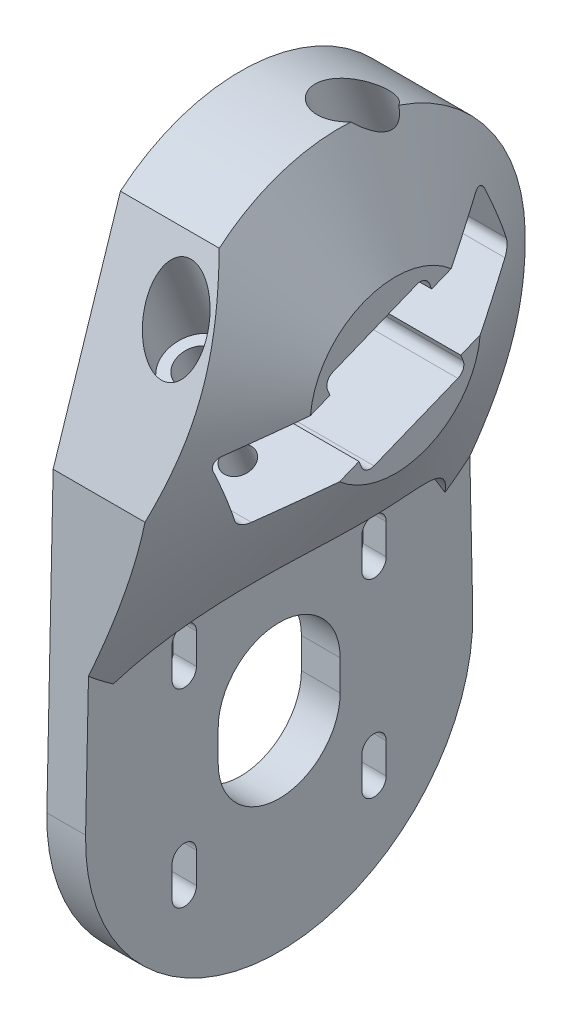
from build123d import *

# Parameters (mm, degrees)
BOSS_EXTRUDE1_DEPTH = 6.35
CUT_EXTRUDE18_DEPTH = 10
SKETCH20_R          = 57.15
BOSS_EXTRUDE5_DEPTH = 19.05
CUT_EXTRUDE14_DEPTH = 111.748555295
SKETCH22_R          = 3.175
CUT_EXTRUDE15_DEPTH = 117.849102749
SKETCH24_R          = 5
CUT_EXTRUDE16_DEPTH = 122.747909556
SKETCH25_R          = 2.38125
CUT_EXTRUDE17_DEPTH = 10
CHAMFER2_SIZE       = 2.5
FILLET1_R           = 1.5875
SKETCH28_R          = 31
CUT_EXTRUDE19_DEPTH = 110.466821527
CUT_EXTRUDE20_DEPTH = 106.059501871
CUT_EXTRUDE21_DEPTH = 101.035906079


with BuildPart() as part:
    # Sketch1 → Boss-Extrude1 (new body)
    with BuildSketch(Plane(origin=(0, 0, 0), x_dir=(0, 0, -1), z_dir=(1, 0, 0))):
        with BuildLine():
            ThreePointArc((30.473090912, 0.648945516), (0, 30.48), (-30.473090912, 0.648945516))
            Line((-30.473090912, 0.648945516), (-31.742803033, -58.974015088))
            ThreePointArc((-31.742803033, -58.974015088), (0, -91.4), (31.742803033, -58.974015088))
            Line((31.742803033, -58.974015088), (30.473090912, 0.648945516))
        make_face()
        Polygon((-11.716114032, 4.97319535), (4.97319535, 11.716114032), (11.716114032, -4.97319535), (-4.97319535, -11.716114032), align=None, mode=Mode.SUBTRACT)
    extrude(amount=BOSS_EXTRUDE1_DEPTH)

    # Sketch19 → Cut-Extrude18 (cut)
    with BuildSketch(Plane(origin=(6.35, 0, 0), x_dir=(0, 0, -1), z_dir=(1, 0, 0))):
        with BuildLine():
            Line((13.556349186, -39.093650814), (13.556349186, -44.093650814))
            ThreePointArc((13.556349186, -44.093650814), (15.556349186, -46.093650814), (17.556349186, -44.093650814))
            Line((17.556349186, -44.093650814), (17.556349186, -39.093650814))
            ThreePointArc((17.556349186, -39.093650814), (15.556349186, -37.093650814), (13.556349186, -39.093650814))
        make_face()
        with BuildLine():
            Line((-10, -54.65), (-10, -59.65))
            ThreePointArc((-10, -59.65), (0, -69.65), (10, -59.65))
            Line((10, -59.65), (10, -54.65))
            ThreePointArc((10, -54.65), (0, -44.65), (-10, -54.65))
        make_face()
        with BuildLine():
            Line((17.556349186, -75.206349186), (17.556349186, -70.206349186))
            ThreePointArc((17.556349186, -70.206349186), (15.556349186, -68.206349186), (13.556349186, -70.206349186))
            Line((13.556349186, -70.206349186), (13.556349186, -75.206349186))
            ThreePointArc((13.556349186, -75.206349186), (15.556349186, -77.206349186), (17.556349186, -75.206349186))
        make_face()
        with BuildLine():
            Line((-17.556349186, -39.093650814), (-17.556349186, -44.093650814))
            ThreePointArc((-17.556349186, -44.093650814), (-15.556349186, -46.093650814), (-13.556349186, -44.093650814))
            Line((-13.556349186, -44.093650814), (-13.556349186, -39.093650814))
            ThreePointArc((-13.556349186, -39.093650814), (-15.556349186, -37.093650814), (-17.556349186, -39.093650814))
        make_face()
        with BuildLine():
            Line((-13.556349186, -75.206349186), (-13.556349186, -70.206349186))
            ThreePointArc((-13.556349186, -70.206349186), (-15.556349186, -68.206349186), (-17.556349186, -70.206349186))
            Line((-17.556349186, -70.206349186), (-17.556349186, -75.206349186))
            ThreePointArc((-17.556349186, -75.206349186), (-15.556349186, -77.206349186), (-13.556349186, -75.206349186))
        make_face()
    extrude(amount=-CUT_EXTRUDE18_DEPTH, mode=Mode.SUBTRACT)

    # Sketch20 → Boss-Extrude5 (add)
    with BuildSketch(Plane(origin=(6.35, 0, 0), x_dir=(0, 0, -1), z_dir=(1, 0, 0))):
        Circle(SKETCH20_R)
    extrude(amount=BOSS_EXTRUDE5_DEPTH)

    # Sketch21 → Cut-Extrude14 (cut, through all)
    with BuildSketch(Plane.ZY):
        Polygon((-19.873660641, 14.878175718), (-24.631164378, 3.102940765), (-10.723406559, -2.516158136), (-11.716114032, -4.97319535), (4.97319535, -11.716114032), (5.965902823, -9.259076817), (19.873660641, -14.878175718), (24.631164378, -3.102940765), (10.723406559, 2.516158136), (11.716114032, 4.97319535), (-4.97319535, 11.716114032), (-5.965902823, 9.259076817), align=None)
    extrude(amount=-CUT_EXTRUDE14_DEPTH, mode=Mode.SUBTRACT)

    # Sketch22 → Cut-Extrude15 (cut, through all)
    with BuildSketch(Plane(origin=(0, 5.887617476, 2.378751868), x_dir=(1, 0, 0), z_dir=(0, -0.9271838545667871, -0.3746065934159129))):
        with Locations((12.5, 16.5)):
            Circle(SKETCH22_R)
    cut_extrude15 = extrude(amount=-CUT_EXTRUDE15_DEPTH, mode=Mode.SUBTRACT)

    # Sketch24 → Cut-Extrude16 (cut, through all)
    with BuildSketch(Plane(origin=(0, 10.597711458, 4.281753363), x_dir=(1, 0, 0), z_dir=(0, -0.9271838545667871, -0.3746065934159129))):
        with Locations((12.5, 16.5)):
            Circle(SKETCH24_R)
    cut_extrude16 = extrude(amount=-CUT_EXTRUDE16_DEPTH, mode=Mode.SUBTRACT)

    # Sketch25 → Cut-Extrude17 (cut)
    with BuildSketch(Plane(origin=(0, -5.887617476, -2.378751868), x_dir=(-1, 0, 0), z_dir=(0, 0.9271838545667864, 0.3746065934159146))):
        with Locations((-12.5, 16.5)):
            Circle(SKETCH25_R)
    cut_extrude17 = extrude(amount=-CUT_EXTRUDE17_DEPTH, mode=Mode.SUBTRACT)

    # Mirror1: Cut-Extrude15, Cut-Extrude16, Cut-Extrude17 across plane
    add(cut_extrude15.mirror(Plane(origin=(0, 0, 0), x_dir=(1, 0, 0), z_dir=(0, 0.37460659341591346, -0.9271838545667869))), mode=Mode.SUBTRACT)
    add(cut_extrude16.mirror(Plane(origin=(0, 0, 0), x_dir=(1, 0, 0), z_dir=(0, 0.37460659341591346, -0.9271838545667869))), mode=Mode.SUBTRACT)
    add(cut_extrude17.mirror(Plane(origin=(0, 0, 0), x_dir=(1, 0, 0), z_dir=(0, 0.37460659341591346, -0.9271838545667869))), mode=Mode.SUBTRACT)


with BuildPart() as body_2:
    # Mirror2: mirrored copy
    add(part.part.mirror(Plane(origin=(0, 0, 0), x_dir=(0, 0, 1), z_dir=(1, 0, 0))))


with BuildPart() as part_1:
    add(part.part)

    # Chamfer2
    chamfer2_edges = [part_1.edges().sort_by_distance(p)[0] for p in [
        (0, -46.093650814, 15.556349186),
        (0, -41.593650814, 13.556349186),
        (0, -37.093650814, 15.556349186),
        (0, -41.593650814, 17.556349186),
        (0, -46.093650814, -15.556349186),
        (0, -41.593650814, -17.556349186),
        (0, -41.593650814, -13.556349186),
        (0, -37.093650814, -15.556349186),
    ]]
    chamfer(chamfer2_edges, length=CHAMFER2_SIZE)

    # Fillet1
    fillet1_edges = [part_1.edges().sort_by_distance(p)[0] for p in [
        (12.7, -4.97319535, -11.716114032),
        (12.7, 3.102940765, -24.631164378),
        (12.7, 11.716114032, -4.97319535),
        (12.7, 14.878175718, -19.873660641),
        (12.7, -3.102940765, 24.631164378),
        (12.7, 4.97319535, 11.716114032),
        (12.7, -11.716114032, 4.97319535),
        (12.7, -14.878175718, 19.873660641),
    ]]
    fillet(fillet1_edges, radius=FILLET1_R)

    # Sketch28 → Cut-Extrude19 (cut, through all)
    with BuildSketch(Plane(origin=(6.35, 0, 0), x_dir=(0, 0, -1), z_dir=(1, 0, 0))):
        with Locations((0, -54.65)):
            Circle(SKETCH28_R)
    extrude(amount=CUT_EXTRUDE19_DEPTH, mode=Mode.SUBTRACT)

    # Sketch31 → Cut-Revolve1 (revolve, cut)
    with BuildSketch(Plane(origin=(0, 0, 0), x_dir=(1, 0, 0), z_dir=(0, 1, 0))):
        Polygon((25.4, -58.97), (25.4, -13.97), (6.35, -48.172984338), (6.35, -58.97), align=None)
    revolve(axis=Axis((25.4, 0, 0), (-1, 0, 0)), mode=Mode.SUBTRACT)

    # Sketch32 → Cut-Extrude20 (cut, through all)
    with BuildSketch(Plane.ZY.offset(-6.35)):
        with BuildLine():
            ThreePointArc((-30.473090912, 0.648945516), (0, 30.48), (30.473090912, 0.648945516))
            Line((30.473090912, 0.648945516), (31.267330303, -36.646834457))
            ThreePointArc((31.267330303, -36.646834457), (0, 48.172984338), (-31.267330303, -36.646834457))
            Line((-31.267330303, -36.646834457), (-30.473090912, 0.648945516))
        make_face()
    extrude(amount=-CUT_EXTRUDE20_DEPTH, mode=Mode.SUBTRACT)

    # Sketch33 → Cut-Extrude21 (cut, through all)
    with BuildSketch(Plane.ZY):
        with BuildLine():
            Line((30.714553642, -10.689626936), (30.473090912, 0.648945516))
            ThreePointArc((30.473090912, 0.648945516), (27.509849022, 13.123970694), (19.678291434, 23.276495575))
            Line((19.678291434, 23.276495575), (30.714553642, -10.689626936))
        make_face()
    extrude(amount=-CUT_EXTRUDE21_DEPTH, mode=Mode.SUBTRACT)


solid = part_1.part
